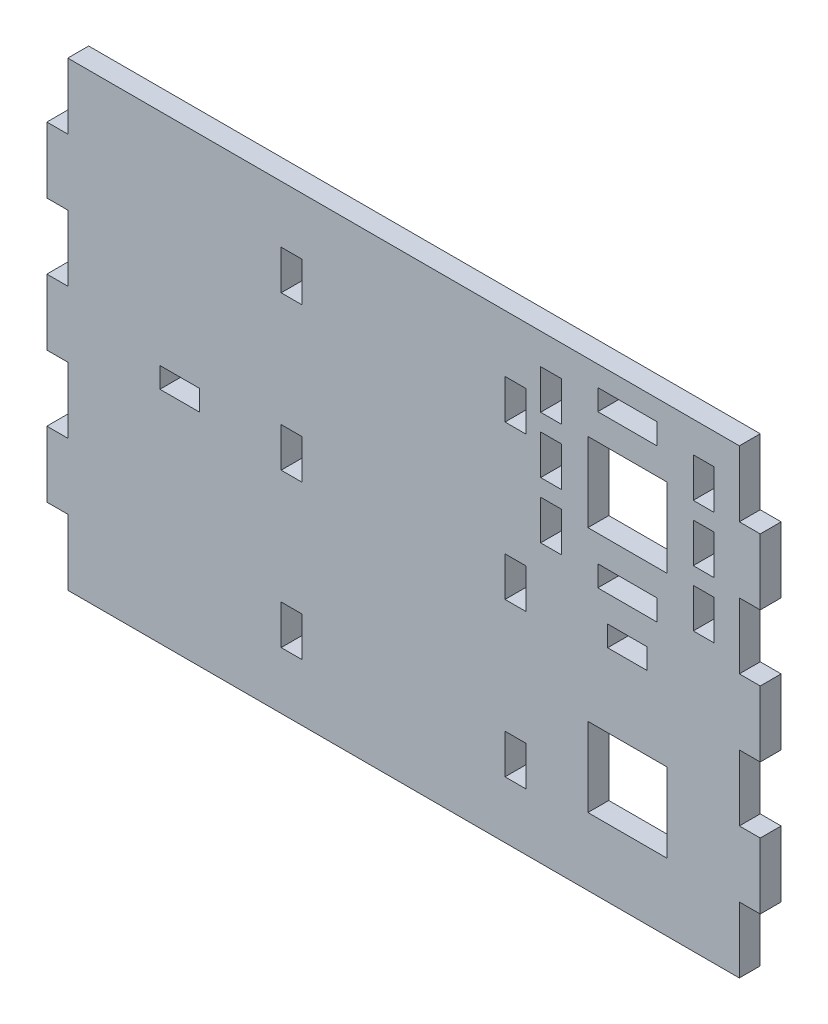
from build123d import *

# Parameters (mm, degrees)
SKETCH1_W           = 6
SKETCH1_H           = 3.125
SKETCH1_W_2         = 9
SKETCH1_H_2         = 3.175
SKETCH1_W_3         = 12
SKETCH1_H_3         = 12
SKETCH1_W_4         = 3.175
SKETCH1_H_4         = 6
BOSS_EXTRUDE1_DEPTH = 1.5875


with BuildPart() as part:
    # Sketch1 → Boss-Extrude1 (new, symmetric)
    with BuildSketch(Plane.XY):
        Polygon((54.175, 5), (51, 5), (51, 15), (54.175, 15), (54.175, 25), (51, 25), (51, 35), (-51, 35), (-51, 25), (-54.175, 25), (-54.175, 15), (-51, 15), (-51, 5), (-54.175, 5), (-54.175, -5), (-51, -5), (-51, -15), (-54.175, -15), (-54.175, -25), (-51, -25), (-51, -35), (51, -35), (51, -25), (54.175, -25), (54.175, -15), (51, -15), (51, -5), (54.175, -5), align=None)
        with Locations((34, 0)):
            Rectangle(SKETCH1_W, SKETCH1_H, mode=Mode.SUBTRACT)
        with Locations((34, 7.15)):
            Rectangle(SKETCH1_W_2, SKETCH1_H_2, mode=Mode.SUBTRACT)
        with Locations((34, 18.7375)):
            Rectangle(SKETCH1_W_3, SKETCH1_H_3, mode=Mode.SUBTRACT)
        with Locations((34, 30.325)):
            Rectangle(SKETCH1_W_2, SKETCH1_H_2, mode=Mode.SUBTRACT)
        with Locations((45.5875, 10.15)):
            Rectangle(SKETCH1_W_4, SKETCH1_H_4, mode=Mode.SUBTRACT)
        with Locations((45.5875, 18.7375)):
            Rectangle(SKETCH1_W_4, SKETCH1_H_4, mode=Mode.SUBTRACT)
        with Locations((45.5875, 27.325)):
            Rectangle(SKETCH1_W_4, SKETCH1_H_4, mode=Mode.SUBTRACT)
        with Locations((34, -18.7375)):
            Rectangle(SKETCH1_W_3, SKETCH1_H_3, mode=Mode.SUBTRACT)
        with Locations((17, 23.333333333)):
            Rectangle(SKETCH1_W_4, SKETCH1_H_4, mode=Mode.SUBTRACT)
        with Locations((22.4125, 27.325)):
            Rectangle(SKETCH1_W_4, SKETCH1_H_4, mode=Mode.SUBTRACT)
        with Locations((-17, -23.333333333)):
            Rectangle(SKETCH1_W_4, SKETCH1_H_4, mode=Mode.SUBTRACT)
        with Locations((17, -23.333333333)):
            Rectangle(SKETCH1_W_4, SKETCH1_H_4, mode=Mode.SUBTRACT)
        with Locations((-34, 0)):
            Rectangle(SKETCH1_W, SKETCH1_H, mode=Mode.SUBTRACT)
        with Locations((-17, 0)):
            Rectangle(SKETCH1_W_4, SKETCH1_H_4, mode=Mode.SUBTRACT)
        with Locations((-17, 23.333333333)):
            Rectangle(SKETCH1_W_4, SKETCH1_H_4, mode=Mode.SUBTRACT)
        with Locations((17, 0)):
            Rectangle(SKETCH1_W_4, SKETCH1_H_4, mode=Mode.SUBTRACT)
        with Locations((22.4125, 10.15)):
            Rectangle(SKETCH1_W_4, SKETCH1_H_4, mode=Mode.SUBTRACT)
        with Locations((22.4125, 18.7375)):
            Rectangle(SKETCH1_W_4, SKETCH1_H_4, mode=Mode.SUBTRACT)
    extrude(amount=BOSS_EXTRUDE1_DEPTH, both=True)


solid = part.part
